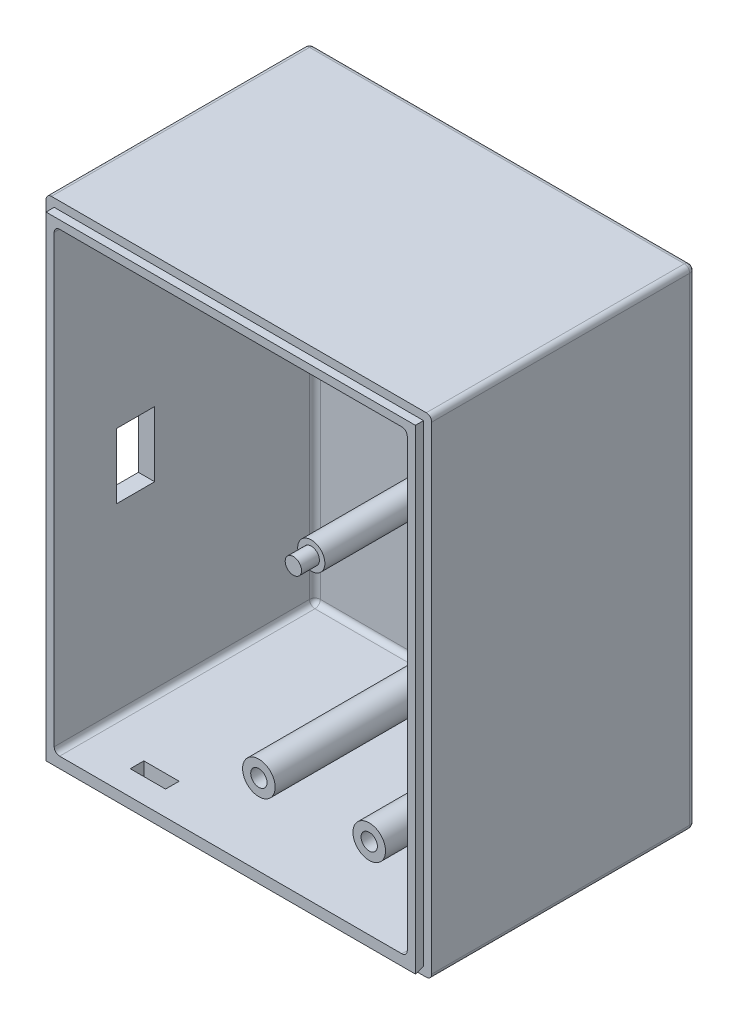
from build123d import *

# Parameters (mm, degrees)
SKETCH1_W                    = 71
SKETCH1_H                    = 90
BOSS_EXTRUDE1_DEPTH          = 50
SHELL1_T                     = -3
SHELL1_THICKNESS_2_FACE_W    = 65
SHELL1_THICKNESS_2_FACE_H    = 84
SHELL1_THICKNESS_2_DEPTH     = 1
SKETCH3_W                    = 6.5
SKETCH3_H                    = 2.5
CUT_EXTRUDE1_DEPTH           = 3
SKETCH4_W                    = 7
SKETCH4_H                    = 12
CUT_EXTRUDE2_DEPTH           = 3
SKETCH5_R                    = 3
SKETCH5_R_2                  = 2.5
BOSS_EXTRUDE2_DEPTH          = 38
F_3_0_3_DIAMETER_HOLE1_D     = 3
F_3_0_3_DIAMETER_HOLE1_DEPTH = 8.5
F_3_0_3_DIAMETER_HOLE1_TIP   = 0.901290929
FILLET1_R                    = 1
FILLET2_R                    = 1
SKETCH22_R                   = 1.5
BOSS_EXTRUDE4_DEPTH          = 3.3
SKETCH23_R                   = 3
BOSS_EXTRUDE5_DEPTH          = 4
CUT_EXTRUDE3_START           = -1.5
CUT_EXTRUDE3_DEPTH           = 1.5
CUT_EXTRUDE4_DEPTH           = 68
SKETCH29_R                   = 3
CUT_EXTRUDE5_DEPTH           = 1.5
SKETCH30_R                   = 1.5
CUT_EXTRUDE6_DEPTH           = 2.5


# Read off the part's stored shape, not the designer's step: Cut-Extrude3
with BuildPart() as part:
    # Sketch1 → Boss-Extrude1 (new body)
    with BuildSketch(Plane.XY):
        Rectangle(SKETCH1_W, SKETCH1_H)
    extrude(amount=-BOSS_EXTRUDE1_DEPTH)

    # Shell1
    shell1_openings = [part.faces().sort_by_distance(p)[0] for p in [
        (0, 0, 0),
    ]]
    offset(amount=SHELL1_T, openings=shell1_openings, kind=Kind.INTERSECTION)

    # Shell1 thickness 2 face (on inner face of the shell) → Shell1 thickness 2 (cut)
    with BuildSketch(Plane(origin=(0, 0, -47), x_dir=(-1, 0, 0), z_dir=(0, 0, -1))):
        Rectangle(SHELL1_THICKNESS_2_FACE_W, SHELL1_THICKNESS_2_FACE_H)
    extrude(amount=SHELL1_THICKNESS_2_DEPTH, mode=Mode.SUBTRACT)

    # Sketch3 → Cut-Extrude1 (cut)
    with BuildSketch(Plane.XZ.offset(45)):
        with Locations((-19.75, -5.75)):
            Rectangle(SKETCH3_W, SKETCH3_H)
    extrude(amount=-CUT_EXTRUDE1_DEPTH, mode=Mode.SUBTRACT)

    # Sketch4 → Cut-Extrude2 (cut)
    with BuildSketch(Plane.ZY.offset(35.5)):
        with Locations((-15, -2)):
            Rectangle(SKETCH4_W, SKETCH4_H)
    extrude(amount=-CUT_EXTRUDE2_DEPTH, mode=Mode.SUBTRACT)

    # Sketch5 → Boss-Extrude2 (add)
    with BuildSketch(Plane.XY.offset(-48)):
        with Locations((-4.82, -37.13)):
            Circle(SKETCH5_R)
        with Locations((15.5, -37.13)):
            Circle(SKETCH5_R)
        with Locations((4.83, 3.15)):
            Circle(SKETCH5_R_2)
    extrude(amount=BOSS_EXTRUDE2_DEPTH)

    # Ø3.0 (3) Diameter Hole1
    with Locations(Plane.XY.offset(-10)):
        with Locations((-4.82, -37.13), (15.5, -37.13), (15.5, 6.05), (-4.82, 6.05)):
            Hole(F_3_0_3_DIAMETER_HOLE1_D / 2, depth=F_3_0_3_DIAMETER_HOLE1_DEPTH)
            with Locations((0, 0, -(F_3_0_3_DIAMETER_HOLE1_DEPTH + F_3_0_3_DIAMETER_HOLE1_TIP / 2))):  # 118° drill point
                Cone(0, F_3_0_3_DIAMETER_HOLE1_D / 2, F_3_0_3_DIAMETER_HOLE1_TIP, mode=Mode.SUBTRACT)

    # Fillet1
    fillet1_edges = [part.edges().sort_by_distance(p)[0] for p in [
        (-35.5, 0, -50),
        (0, -45, -50),
        (32.5, 42, -24),
        (32.5, -42, -24),
        (-32.5, -42, -24),
        (-32.5, 42, -24),
        (35.5, 0, -50),
        (0, 45, -50),
        (35.5, -45, -25),
        (-35.5, -45, -25),
        (-35.5, 45, -25),
        (35.5, 45, -25),
    ]]
    fillet(fillet1_edges, radius=FILLET1_R)

    # Fillet2
    # the kernel refuses this fillet: 1 mm, written as the material it adds along each edge
    with BuildSketch(Plane(origin=(-4.82, -37.13, -48), x_dir=(1, 0, 0), z_dir=(0, -1, 0))) as fillet2_piece_1:
        with BuildLine():
            CenterArc((3 + FILLET2_R, FILLET2_R), FILLET2_R, 180, 90)
            Line((3, FILLET2_R), (3, 0))
            Line((3, 0), (3 + FILLET2_R, 0))
        make_face()
    revolve(axis=Axis((-4.82, -37.13, -48), (0, 0, 1)))
    with BuildSketch(Plane(origin=(15.5, -37.13, -48), x_dir=(1, 0, 0), z_dir=(0, -1, 0))) as fillet2_piece_2:
        with BuildLine():
            CenterArc((3 + FILLET2_R, FILLET2_R), FILLET2_R, 180, 90)
            Line((3, FILLET2_R), (3, 0))
            Line((3, 0), (3 + FILLET2_R, 0))
        make_face()
    revolve(axis=Axis((15.5, -37.13, -48), (0, 0, 1)))
    with BuildSketch(Plane(origin=(4.83, 3.15, -48), x_dir=(1, 0, 0), z_dir=(0, -1, 0))) as fillet2_piece_3:
        with BuildLine():
            CenterArc((2.5 + FILLET2_R, FILLET2_R), FILLET2_R, 180, 90)
            Line((2.5, FILLET2_R), (2.5, 0))
            Line((2.5, 0), (2.5 + FILLET2_R, 0))
        make_face()
    revolve(axis=Axis((4.83, 3.15, -48), (0, 0, 1)))
    with BuildSketch(Plane(origin=(31.5, 42, -48), x_dir=(0, 0, 1), z_dir=(-1, 0, 0)), Plane(origin=(-31.5, -42, -48), x_dir=(0, 0, 1), z_dir=(1, 0, 0))) as fillet2_piece_4:
        with BuildLine():
            CenterArc((FILLET2_R, -FILLET2_R), FILLET2_R, 90, 90)
            Line((0, -FILLET2_R), (0, 0))
            Line((0, 0), (FILLET2_R, 0))
        make_face()
    extrude(amount=63)
    with BuildSketch(Plane(origin=(32.5, -41, -48), x_dir=(0, 0, 1), z_dir=(0, 1, 0)), Plane(origin=(-32.5, 41, -48), x_dir=(0, 0, 1), z_dir=(0, -1, 0))) as fillet2_piece_5:
        with BuildLine():
            CenterArc((FILLET2_R, -FILLET2_R), FILLET2_R, 90, 90)
            Line((0, -FILLET2_R), (0, 0))
            Line((0, 0), (FILLET2_R, 0))
        make_face()
    extrude(amount=82)
    with BuildSketch(Plane(origin=(-31.5, -41, -48), x_dir=(-1, 0, 0), z_dir=(0, 1, 0))) as fillet2_piece_6:
        with BuildLine():
            CenterArc((1 - FILLET2_R, FILLET2_R), FILLET2_R, 270, 90)
            Line((1 - FILLET2_R, 0), (1, 0))
            Line((1, 0), (1, FILLET2_R))
        make_face()
    revolve(axis=Axis((-31.5, -41, -48), (0, 0, 1)), revolution_arc=90)
    with BuildSketch(Plane(origin=(-31.5, 41, -48), x_dir=(0, 1, 0), z_dir=(1, 0, 0))) as fillet2_piece_7:
        with BuildLine():
            CenterArc((1 - FILLET2_R, FILLET2_R), FILLET2_R, 270, 90)
            Line((1 - FILLET2_R, 0), (1, 0))
            Line((1, 0), (1, FILLET2_R))
        make_face()
    revolve(axis=Axis((-31.5, 41, -48), (0, 0, 1)), revolution_arc=90)
    with BuildSketch(Plane(origin=(31.5, -41, -48), x_dir=(0, -1, 0), z_dir=(-1, 0, 0))) as fillet2_piece_8:
        with BuildLine():
            CenterArc((1 - FILLET2_R, FILLET2_R), FILLET2_R, 270, 90)
            Line((1 - FILLET2_R, 0), (1, 0))
            Line((1, 0), (1, FILLET2_R))
        make_face()
    revolve(axis=Axis((31.5, -41, -48), (0, 0, 1)), revolution_arc=90)
    with BuildSketch(Plane(origin=(31.5, 41, -48), x_dir=(0, 1, 0), z_dir=(-1, 0, 0))) as fillet2_piece_9:
        with BuildLine():
            CenterArc((1 - FILLET2_R, -FILLET2_R), FILLET2_R, 0, 90)
            Line((1 - FILLET2_R, 0), (1, 0))
            Line((1, 0), (1, -FILLET2_R))
        make_face()
    revolve(axis=Axis((31.5, 41, -48), (0, 0, -1)), revolution_arc=90)

    # Sketch22 → Boss-Extrude4 (add)
    with BuildSketch(Plane.XY.offset(-10)):
        with Locations((4.83, 3.15)):
            Circle(SKETCH22_R)
    extrude(amount=BOSS_EXTRUDE4_DEPTH)

    # Sketch23 → Boss-Extrude5 (add)
    with BuildSketch(Plane(origin=(0, 0, -50), x_dir=(-1, 0, 0), z_dir=(0, 0, -1))):
        with Locations((-20.5, 30)):
            Circle(SKETCH23_R)
    extrude(amount=-BOSS_EXTRUDE5_DEPTH)

    # Cut-Extrude3 outline → Cut-Extrude3 (cut)
    with BuildSketch(Plane.XY.offset(CUT_EXTRUDE3_START)):
        with BuildLine():
            Line((-34, 43.5), (34, 43.5))
            Line((34, 43.5), (34, -45))
            Line((34, -45), (34.5, -45))
            ThreePointArc((34.5, -45), (35.207106781, -44.707106781), (35.5, -44))
            Line((35.5, -44), (35.5, 44))
            ThreePointArc((35.5, 44), (35.207106781, 44.707106781), (34.5, 45))
            Line((34.5, 45), (-34.5, 45))
            ThreePointArc((-34.5, 45), (-35.207106781, 44.707106781), (-35.5, 44))
            Line((-35.5, 44), (-35.5, -44))
            ThreePointArc((-35.5, -44), (-35.207106781, -44.707106781), (-34.5, -45))
            Line((-34.5, -45), (-34, -45))
            Line((-34, -45), (-34, 43.5))
        make_face()
    extrude(amount=CUT_EXTRUDE3_DEPTH, mode=Mode.SUBTRACT)

    # Sketch26 → Cut-Extrude4 (cut)
    with BuildSketch(Plane.ZY.offset(34)):
        Polygon((0, -45), (0, -44), (-1.5, -43.5), (-1.5, -45), align=None)
    extrude(amount=-CUT_EXTRUDE4_DEPTH, mode=Mode.SUBTRACT)

    # Sketch29 → Cut-Extrude5 (cut)
    with BuildSketch(Plane(origin=(0, 0, -50), x_dir=(-1, 0, 0), z_dir=(0, 0, -1))):
        with Locations((-20.5, 30)):
            Circle(SKETCH29_R)
    extrude(amount=-CUT_EXTRUDE5_DEPTH, mode=Mode.SUBTRACT)

    # Sketch30 → Cut-Extrude6 (cut)
    with BuildSketch(Plane(origin=(0, 0, -48.5), x_dir=(-1, 0, 0), z_dir=(0, 0, -1))):
        with Locations((-20.5, 30)):
            Circle(SKETCH30_R)
    extrude(amount=-CUT_EXTRUDE6_DEPTH, mode=Mode.SUBTRACT)


solid = part.part
